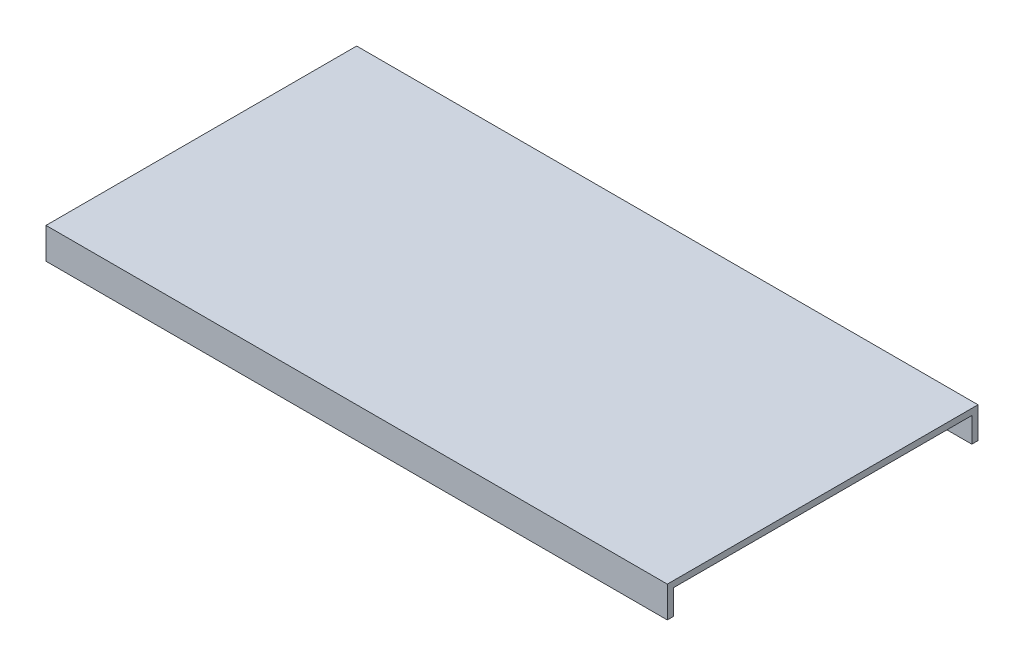
from build123d import *

# Parameters (mm, degrees)
SKIZZE1_W                       = 1000
SKIZZE1_H                       = 50
AUFSATZ_LINEAR_AUSTRAGEN1_DEPTH = 500
SKIZZE2_W                       = 480
SKIZZE2_H                       = 40
SCHNITT_LINEAR_AUSTRAGEN1_DEPTH = 1120.15146428


with BuildPart() as part:
    # Skizze1 → Aufsatz-Linear austragen1 (new body)
    with BuildSketch(Plane.XY):
        with Locations((500, 25)):
            Rectangle(SKIZZE1_W, SKIZZE1_H)
    extrude(amount=AUFSATZ_LINEAR_AUSTRAGEN1_DEPTH)

    # Skizze2 → Schnitt-Linear austragen1 (cut, through all)
    with BuildSketch(Plane(origin=(1000, 0, 0), x_dir=(0, 0, -1), z_dir=(1, 0, 0))):
        with Locations((-250, 20)):
            Rectangle(SKIZZE2_W, SKIZZE2_H)
    extrude(amount=-SCHNITT_LINEAR_AUSTRAGEN1_DEPTH, mode=Mode.SUBTRACT)


solid = part.part
